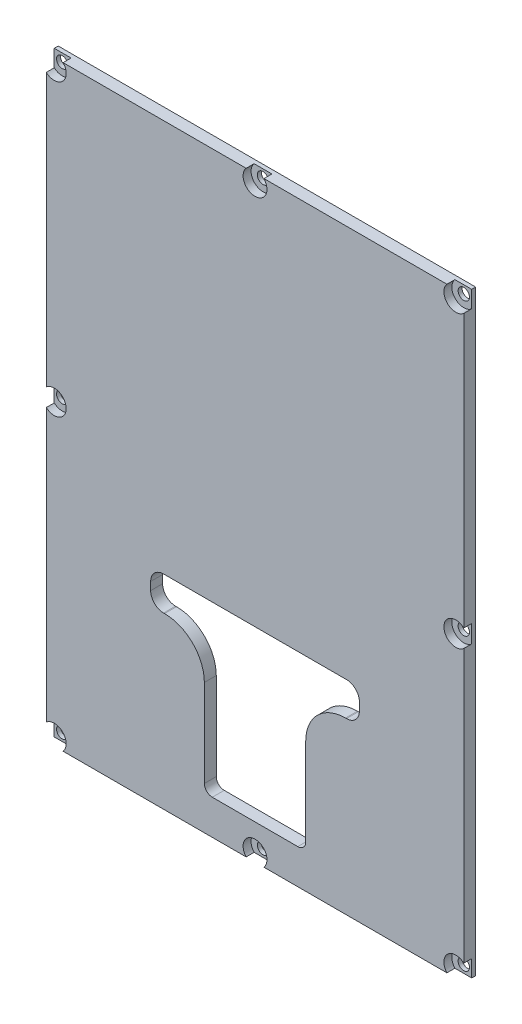
from build123d import *

# Parameters (mm, degrees)
SKETCH_1_W          = 105
SKETCH_1_H          = 150
EXTRUDE_1_DEPTH     = 3
CUT_EXTRUDE_1_DEPTH = 10
SKETCH_3_R          = 3
CUT_EXTRUDE_2_DEPTH = 2
SKETCH_4_R          = 1.425
CUT_EXTRUDE_3_DEPTH = 2


with BuildPart() as part:
    # Эскиз1 → Бобышка-Вытянуть1 (new body)
    with BuildSketch(Plane.XY):
        Rectangle(SKETCH_1_W, SKETCH_1_H)
    extrude(amount=EXTRUDE_1_DEPTH)

    # Эскиз2 → Вырез-Вытянуть1 (cut)
    with BuildSketch(Plane(origin=(0, 0, 0), x_dir=(-1, 0, 0), z_dir=(0, 0, -1))):
        with BuildLine():
            Line((-26.25, -27), (-26.25, -29))
            ThreePointArc((-26.25, -29), (-25.298097039, -31.298097039), (-23, -32.25))
            Line((-23, -32.25), (-22.75, -32.25))
            ThreePointArc((-22.75, -32.25), (-15.678932188, -35.178932188), (-12.75, -42.25))
            Line((-12.75, -42.25), (-12.75, -64.25))
            ThreePointArc((-12.75, -64.25), (-12.164213562, -65.664213562), (-10.75, -66.25))
            Line((-10.75, -66.25), (10.75, -66.25))
            ThreePointArc((10.75, -66.25), (12.164213562, -65.664213562), (12.75, -64.25))
            Line((12.75, -64.25), (12.75, -42.25))
            ThreePointArc((12.75, -42.25), (15.678932188, -35.178932188), (22.75, -32.25))
            Line((22.75, -32.25), (23, -32.25))
            ThreePointArc((23, -32.25), (25.298097039, -31.298097039), (26.25, -29))
            Line((26.25, -29), (26.25, -27))
            ThreePointArc((26.25, -27), (25.298097039, -24.701902961), (23, -23.75))
            Line((23, -23.75), (-23, -23.75))
            ThreePointArc((-23, -23.75), (-25.298097039, -24.701902961), (-26.25, -27))
        make_face()
    extrude(amount=-CUT_EXTRUDE_1_DEPTH, mode=Mode.SUBTRACT)

    # Эскиз3 → Вырез-Вытянуть2 (cut)
    with BuildSketch(Plane.XY.offset(3)):
        with Locations((-50.5, 73)):
            Circle(SKETCH_3_R)
        with Locations((0, 73)):
            Circle(SKETCH_3_R)
        with Locations((50.5, 73)):
            Circle(SKETCH_3_R)
        with Locations((50.5, 0)):
            Circle(SKETCH_3_R)
        with Locations((50.5, -73)):
            Circle(SKETCH_3_R)
        with Locations((0, -73)):
            Circle(SKETCH_3_R)
        with Locations((-50.5, -73)):
            Circle(SKETCH_3_R)
        with Locations((-50.5, 0)):
            Circle(SKETCH_3_R)
    extrude(amount=-CUT_EXTRUDE_2_DEPTH, mode=Mode.SUBTRACT)

    # Эскиз4 → Вырез-Вытянуть3 (cut)
    with BuildSketch(Plane.XY.offset(1)):
        with Locations((-50.5, 73)):
            Circle(SKETCH_4_R)
        with Locations((0, 73)):
            Circle(SKETCH_4_R)
        with Locations((50.5, 73)):
            Circle(SKETCH_4_R)
        with Locations((50.5, 0)):
            Circle(SKETCH_4_R)
        with Locations((50.5, -73)):
            Circle(SKETCH_4_R)
        with Locations((0, -73)):
            Circle(SKETCH_4_R)
        with Locations((-50.5, -73)):
            Circle(SKETCH_4_R)
        with Locations((-50.5, 0)):
            Circle(SKETCH_4_R)
    extrude(amount=-CUT_EXTRUDE_3_DEPTH, mode=Mode.SUBTRACT)


solid = part.part
